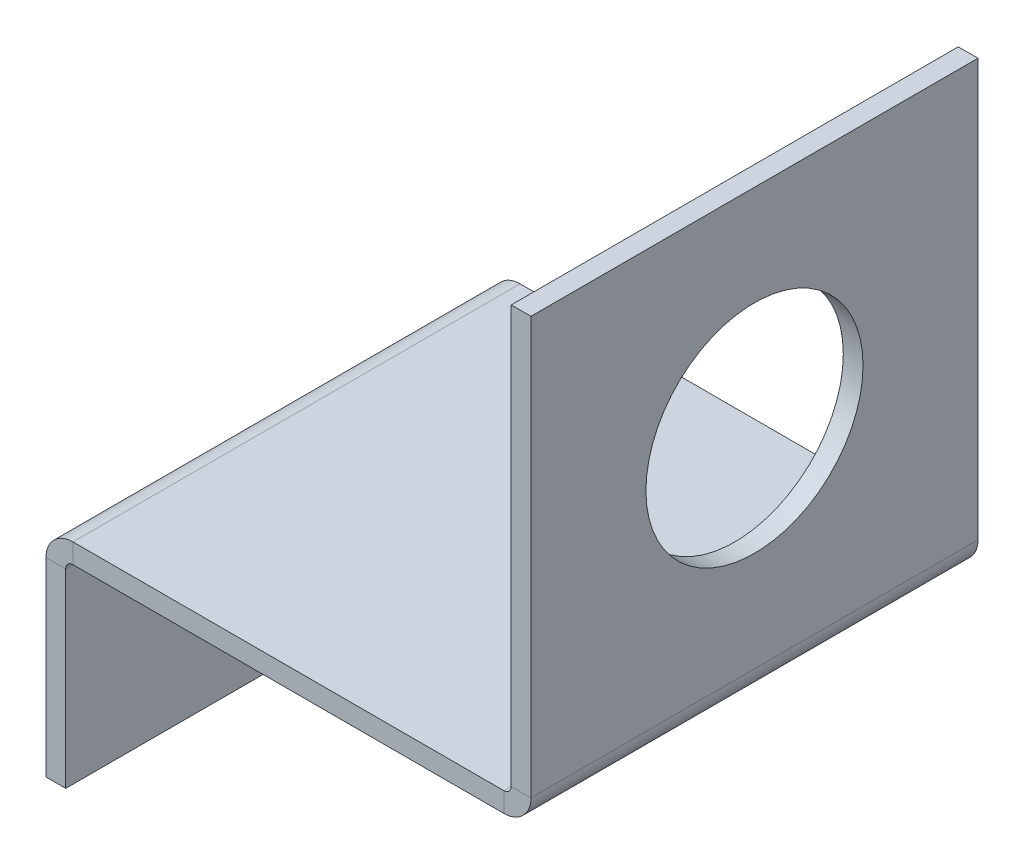
from build123d import *

# Parameters (mm, degrees)
SCHIZZO9_W                     = 45.3
SCHIZZO9_H                     = 22
BASE_FLANGIA2_DEPTH            = 2
BORDO_FLANGIA2_STRIP_W         = 9.4732
BORDO_FLANGIA2_STRIP_H         = 2
BORDO_FLANGIA2_STRIP_CUT_DEPTH = 45.3
BORDO_FLANGIA2_DEPTH           = 45.3
BORDO_FLANGIA3_STRIP_W         = 9.4732
BORDO_FLANGIA3_STRIP_H         = 2
BORDO_FLANGIA3_STRIP_CUT_DEPTH = 45.3
BORDO_FLANGIA3_DEPTH           = 45.3
SCHIZZO22_R                    = 11
TAGLIO_ESTRUSIONE1_DEPTH       = 10


# Sheet-metal steps are written as plain solids
with BuildPart() as part:
    # Schizzo9 → Base-Flangia2 (new body)
    with BuildSketch(Plane(origin=(0, 0, 0), x_dir=(0, 0, -1), z_dir=(1, 0, 0))):
        with Locations((22.65, -11)):
            Rectangle(SCHIZZO9_W, SCHIZZO9_H)
    extrude(amount=-BASE_FLANGIA2_DEPTH)

    # Bordo-Flangia2 strip (across the edge) → Bordo-Flangia2 strip cut (cut)
    with BuildSketch(Plane(origin=(0, 0, -45.3), x_dir=(0, -1, 0), z_dir=(0, 0, 1))):
        with Locations((-2, -1)):
            Rectangle(BORDO_FLANGIA2_STRIP_W, BORDO_FLANGIA2_STRIP_H)
    extrude(amount=BORDO_FLANGIA2_STRIP_CUT_DEPTH, mode=Mode.SUBTRACT)

    # Bordo-Flangia2 section (across the edge) → Bordo-Flangia2 (add)
    with BuildSketch(Plane(origin=(0, 0, -45.3), x_dir=(0, -1, 0), z_dir=(0, 0, 1))):
        with BuildLine():
            Line((0, 0.7366), (0, 47.143791264))
            Line((0, 47.143791264), (2, 47.143791264))
            Line((2, 47.143791264), (2, 0.7366))
            ThreePointArc((2, 0.7366), (2.215745145, 0.215745145), (2.7366, 0))
            Line((2.7366, 0), (2.7366, -2))
            ThreePointArc((2.7366, -2), (0.801531583, -1.198468417), (0, 0.7366))
        make_face()
    extrude(amount=BORDO_FLANGIA2_DEPTH)

    # Bordo-Flangia3 strip (across the edge) → Bordo-Flangia3 strip cut (cut)
    with BuildSketch(Plane(origin=(47.143791264, 0, 0), x_dir=(-1, 0, 0), z_dir=(0, 0, -1))):
        with Locations((-2, -1)):
            Rectangle(BORDO_FLANGIA3_STRIP_W, BORDO_FLANGIA3_STRIP_H)
    extrude(amount=BORDO_FLANGIA3_STRIP_CUT_DEPTH, mode=Mode.SUBTRACT)

    # Bordo-Flangia3 section (across the edge) → Bordo-Flangia3 (add)
    with BuildSketch(Plane(origin=(47.143791264, 0, 0), x_dir=(-1, 0, 0), z_dir=(0, 0, -1))):
        with BuildLine():
            Line((0, 0.7366), (0, 43))
            Line((0, 43), (2, 43))
            Line((2, 43), (2, 0.7366))
            ThreePointArc((2, 0.7366), (2.215745145, 0.215745145), (2.7366, 0))
            Line((2.7366, 0), (2.7366, -2))
            ThreePointArc((2.7366, -2), (0.801531583, -1.198468417), (0, 0.7366))
        make_face()
    extrude(amount=BORDO_FLANGIA3_DEPTH)

    # Schizzo22 → Taglio-Estrusione1 (cut)
    with BuildSketch(Plane(origin=(47.143791264, 0, 0), x_dir=(0, 0, -1), z_dir=(1, 0, 0))):
        with Locations((22.65, 21.8683)):
            Circle(SCHIZZO22_R)
    extrude(amount=-TAGLIO_ESTRUSIONE1_DEPTH, mode=Mode.SUBTRACT)


solid = part.part
